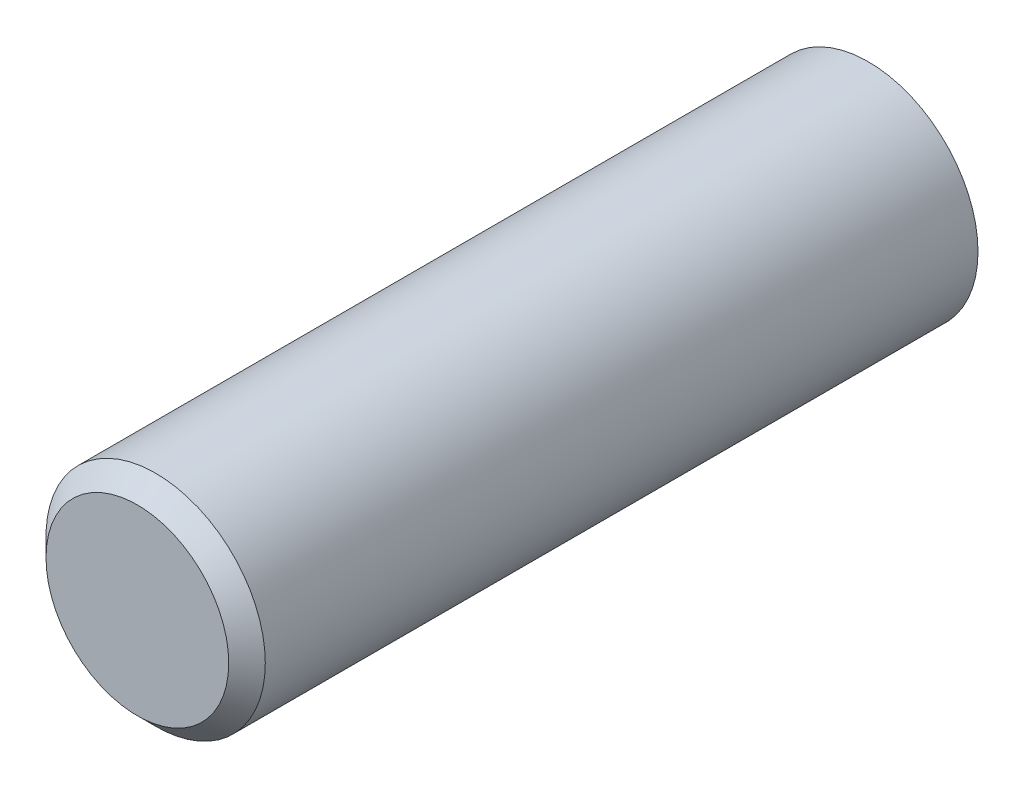
from build123d import *

# Parameters (mm, degrees)
ESQUISSE1_R        = 3
BOSS_EXTRU_1_DEPTH = 20
CHANFREIN1_SIZE    = 0.5


with BuildPart() as part:
    # Esquisse1 → Boss.-Extru.1 (new body)
    with BuildSketch(Plane.XY):
        Circle(ESQUISSE1_R)
    extrude(amount=BOSS_EXTRU_1_DEPTH)

    # Chanfrein1
    chanfrein1_edges = [part.edges().sort_by_distance(p)[0] for p in [
        (-3, 0, 20),
    ]]
    chamfer(chanfrein1_edges, length=CHANFREIN1_SIZE)


solid = part.part
